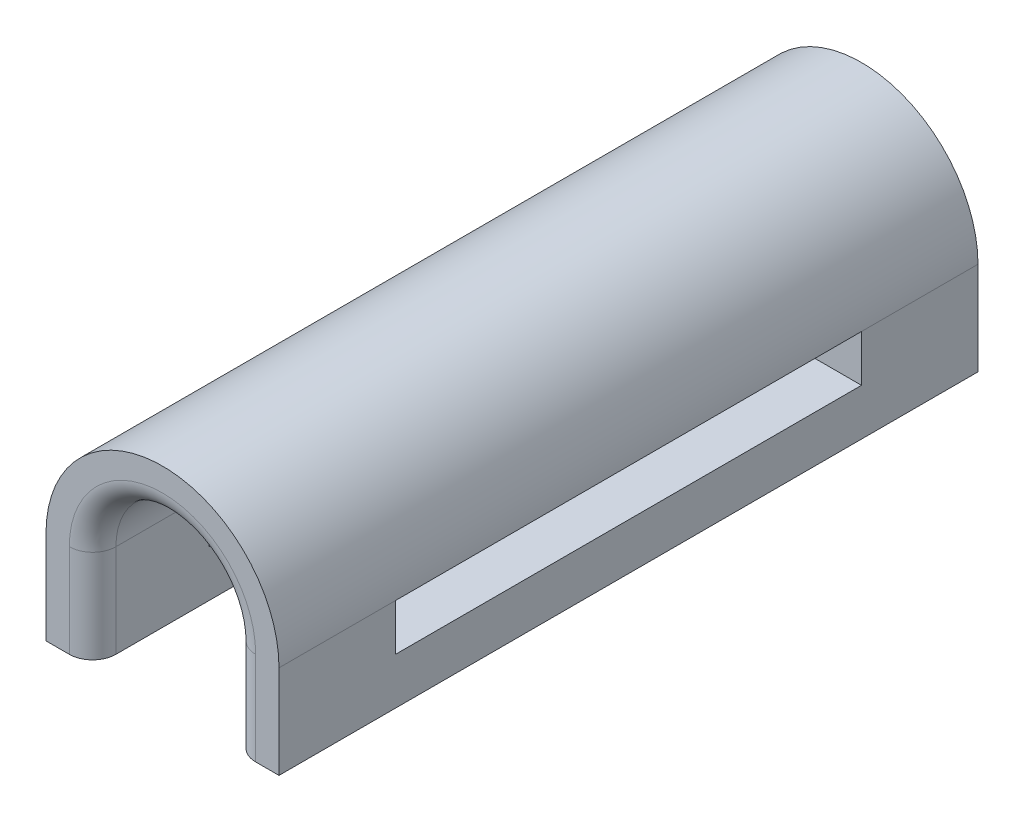
from build123d import *

# Parameters (mm, degrees)
DODANIE_WYCI_GNI_CIE2_DEPTH = 15
SZKIC3_W                    = 1
SZKIC3_H                    = 2.5
DODANIE_WYCI_GNI_CIE3_DEPTH = 2
SZKIC4_W                    = 1
SZKIC4_H                    = 1
DODANIE_WYCI_GNI_CIE4_DEPTH = 10
ZAOKR_GLENIE1_R             = 0.5


with BuildPart() as part:
    # Szkic1 → Dodanie-wyciągnięcie2 (new body)
    with BuildSketch(Plane.XY):
        with BuildLine():
            Line((-2.5, 0), (-1.5, 0))
            ThreePointArc((-1.5, 0), (0, 1.5), (1.5, 0))
            Line((1.5, 0), (2.5, 0))
            ThreePointArc((2.5, 0), (0, 2.5), (-2.5, 0))
        make_face()
    extrude(amount=DODANIE_WYCI_GNI_CIE2_DEPTH)

    # Szkic3 → Dodanie-wyciągnięcie3 (add)
    with BuildSketch(Plane.XZ):
        with Locations((-2, 13.75)):
            Rectangle(SZKIC3_W, SZKIC3_H)
        with Locations((2, 13.75)):
            Rectangle(SZKIC3_W, SZKIC3_H)
        with Locations((2, 1.25)):
            Rectangle(SZKIC3_W, SZKIC3_H)
        with Locations((-2, 1.25)):
            Rectangle(SZKIC3_W, SZKIC3_H)
    extrude(amount=DODANIE_WYCI_GNI_CIE3_DEPTH)

    # Szkic4 → Dodanie-wyciągnięcie4 (add)
    with BuildSketch(Plane(origin=(0, 0, 12.5), x_dir=(-1, 0, 0), z_dir=(0, 0, -1))):
        with Locations((2, -1.5)):
            Rectangle(SZKIC4_W, SZKIC4_H)
        with Locations((-2, -1.5)):
            Rectangle(SZKIC4_W, SZKIC4_H)
    extrude(amount=DODANIE_WYCI_GNI_CIE4_DEPTH)

    # Zaokrąglenie1
    zaokr_glenie1_edges = [part.edges().sort_by_distance(p)[0] for p in [
        (-1.5, -1, 0),
        (1.5, -1, 0),
        (-1.5, -1, 15),
        (1.5, -1, 15),
        (0, 1.5, 0),
        (0, 1.5, 15),
    ]]
    fillet(zaokr_glenie1_edges, radius=ZAOKR_GLENIE1_R)


solid = part.part
